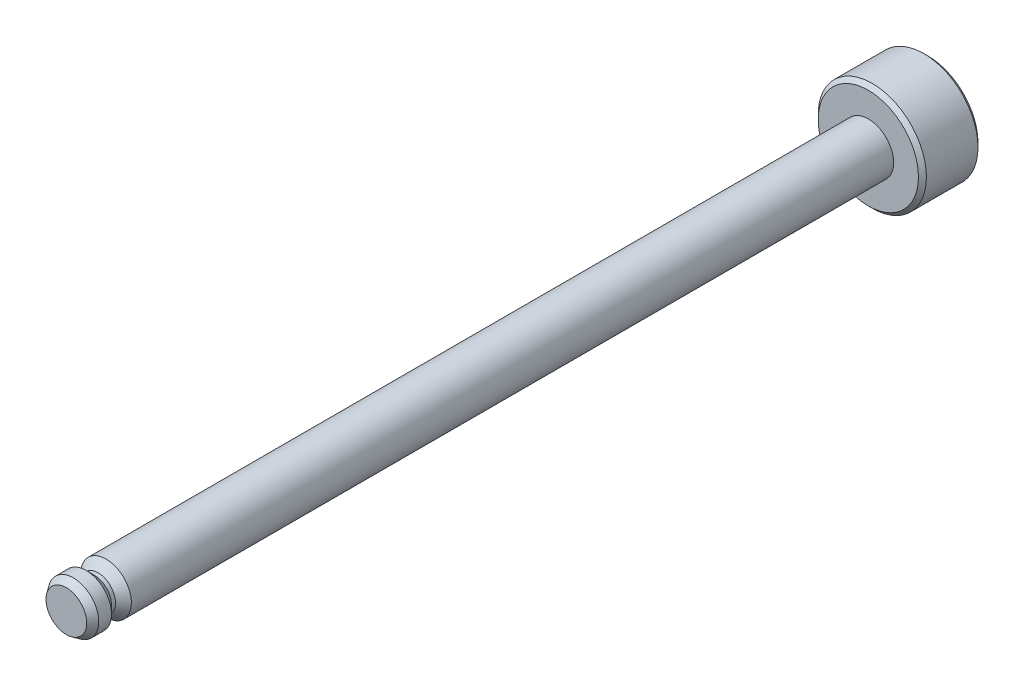
from build123d import *

# Parameters (mm, degrees)
SKETCH2_R      = 1.275
SHAFT_DEPTH    = 40.4
SKETCH5_R      = 2.725
HEAD_DEPTH     = 3
CHAMFER1_SIZE  = 0.25
CHAMFER1_SIZE2 = 0.357037002
DEBURS_SIZE    = 0.2


with BuildPart() as part:
    # Sketch2 → Shaft (new body)
    with BuildSketch(Plane.XY):
        Circle(SKETCH2_R)
    extrude(amount=SHAFT_DEPTH)

    # Sketch5 → Head (add)
    with BuildSketch(Plane.XY):
        Circle(SKETCH5_R)
    extrude(amount=-HEAD_DEPTH)

    # Chamfer1
    chamfer1_edges = [part.edges().sort_by_distance(p)[0] for p in [
        (-1.275, 0, 40.4),
    ]]
    chamfer1_side = [part.faces().sort_by_distance(p)[0] for p in [
        (0, 0, 40.4),
    ]]
    chamfer(chamfer1_edges, length=CHAMFER1_SIZE, length2=CHAMFER1_SIZE2, reference=chamfer1_side[0])

    # Deburs
    deburs_edges = [part.edges().sort_by_distance(p)[0] for p in [
        (-2.725, 0, 0),
        (-2.725, 0, -3),
    ]]
    chamfer(deburs_edges, length=DEBURS_SIZE)

    # Sketch6 → e-Clip Notch Long (revolve, cut)
    with BuildSketch(Plane(origin=(0, 0, 0), x_dir=(0, 0, -1), z_dir=(1, 0, 0))):
        Polygon((-39.4, 1.275), (-38.4, 1.275), (-38.8, 0.875), (-39, 0.875), align=None)
    revolve(axis=Axis((0, 0, 0), (0, 0, 1)), mode=Mode.SUBTRACT)


solid = part.part
